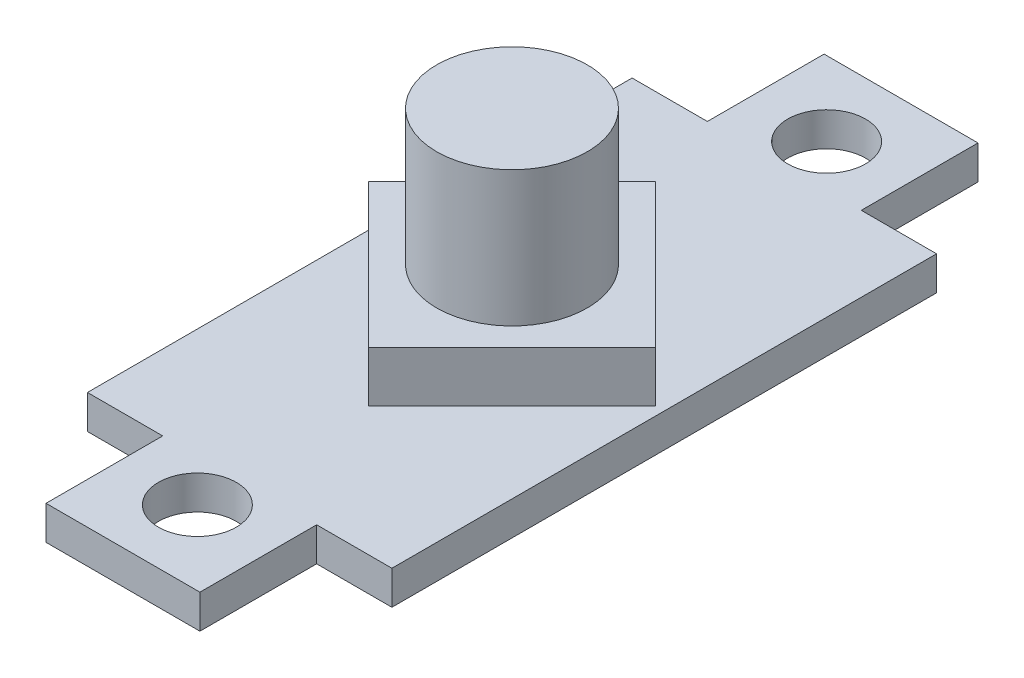
from build123d import *

# Parameters (mm, degrees)
SKETCH1_R           = 1.15
BOSS_EXTRUDE1_DEPTH = 1
BOSS_EXTRUDE2_DEPTH = 1.5
SKETCH3_R           = 2.226640197
BOSS_EXTRUDE3_DEPTH = 4


with BuildPart() as part:
    # Sketch1 → Boss-Extrude1 (new body)
    with BuildSketch(Plane(origin=(0, 0, 0), x_dir=(1, 0, 0), z_dir=(0, 1, 0))):
        Polygon((2.275, 11.5), (-2.275, 11.5), (-2.275, 8.05), (-4.5, 8.05), (-4.5, -8.05), (-2.275, -8.05), (-2.275, -11.5), (2.275, -11.5), (2.275, -8.05), (4.5, -8.05), (4.5, 8.05), (2.275, 8.05), align=None)
        with Locations((0, 9.3)):
            Circle(SKETCH1_R, mode=Mode.SUBTRACT)
        with Locations((0, -9.3)):
            Circle(SKETCH1_R, mode=Mode.SUBTRACT)
    extrude(amount=BOSS_EXTRUDE1_DEPTH)

    # Sketch2 → Boss-Extrude2 (add)
    with BuildSketch(Plane(origin=(0, 1, 0), x_dir=(1, 0, 0), z_dir=(0, 1, 0))):
        Polygon((0, -4.242640687), (4.242640687, 0), (0, 4.242640687), (-4.242640687, 0), align=None)
    extrude(amount=BOSS_EXTRUDE2_DEPTH)

    # Sketch3 → Boss-Extrude3 (add)
    with BuildSketch(Plane(origin=(0, 2.5, 0), x_dir=(1, 0, 0), z_dir=(0, 1, 0))):
        Circle(SKETCH3_R)
    extrude(amount=BOSS_EXTRUDE3_DEPTH)


solid = part.part
